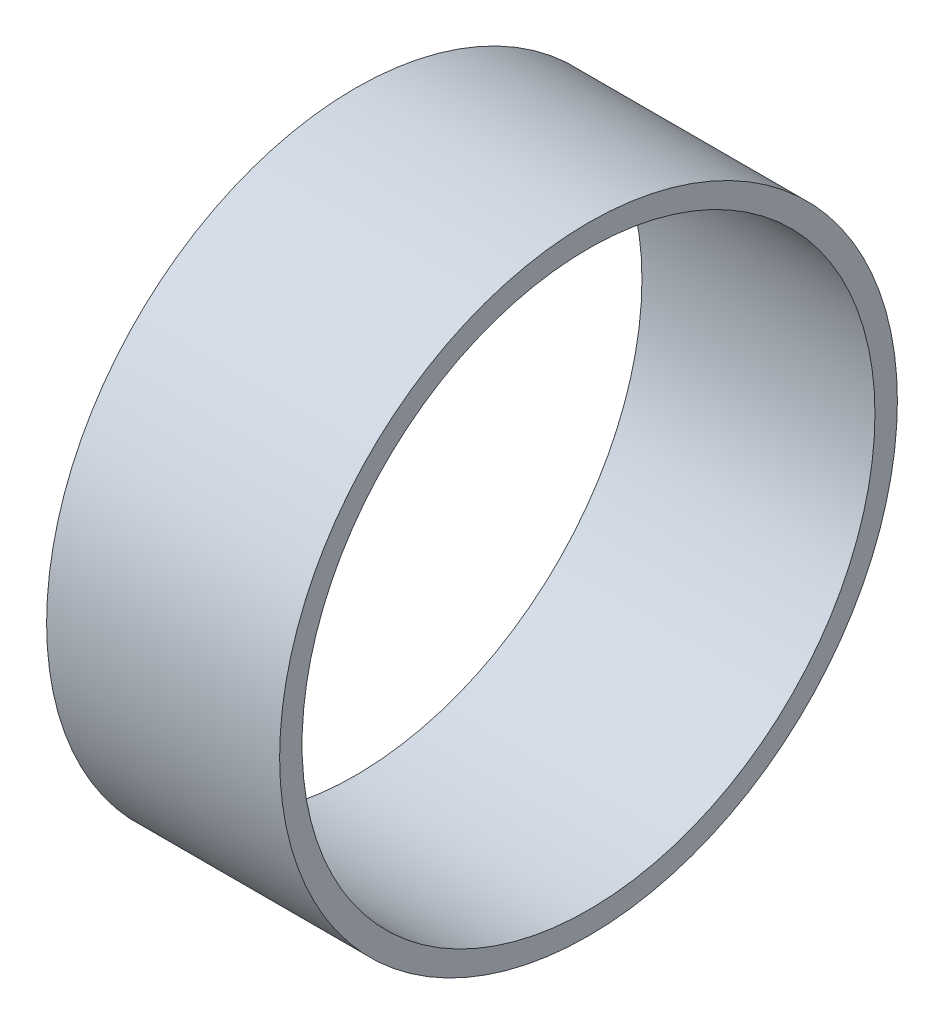
from build123d import *

# Parameters (mm, degrees)
SKETCH1_R           = 26.9367
SKETCH1_R_2         = 24.9809
BOSS_EXTRUDE1_DEPTH = 10.16


with BuildPart() as part:
    # Sketch1 → Boss-Extrude1 (new, symmetric)
    with BuildSketch(Plane(origin=(0, 0, 0), x_dir=(0, 0, -1), z_dir=(1, 0, 0))):
        Circle(SKETCH1_R)
        Circle(SKETCH1_R_2, mode=Mode.SUBTRACT)
    extrude(amount=BOSS_EXTRUDE1_DEPTH, both=True)


solid = part.part
